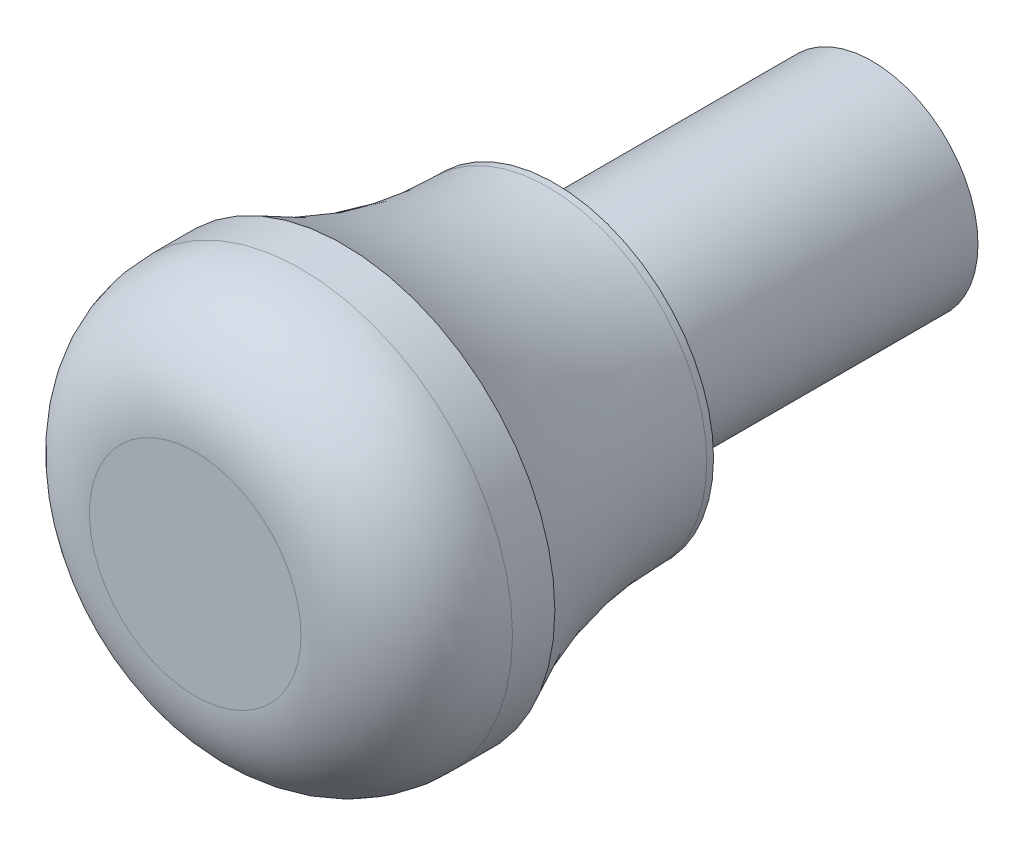
from build123d import *

# Parameters (mm, degrees)
SKETCH1_R           = 5
BOSS_EXTRUDE1_DEPTH = 15
SKETCH2_R           = 7.5
BOSS_EXTRUDE2_DEPTH = 10
SKETCH3_R           = 10
BOSS_EXTRUDE3_DEPTH = 7
FILLET1_R           = 20
FILLET2_R           = 5


with BuildPart() as part:
    # Sketch1 → Boss-Extrude1 (new body)
    with BuildSketch(Plane.XY):
        Circle(SKETCH1_R)
    extrude(amount=BOSS_EXTRUDE1_DEPTH)

    # Sketch2 → Boss-Extrude2 (add)
    with BuildSketch(Plane.XY.offset(15)):
        Circle(SKETCH2_R)
    extrude(amount=BOSS_EXTRUDE2_DEPTH)

    # Sketch3 → Boss-Extrude3 (add)
    with BuildSketch(Plane.XY.offset(25)):
        Circle(SKETCH3_R)
    extrude(amount=BOSS_EXTRUDE3_DEPTH)

    # Fillet1
    # the kernel refuses this fillet: 20 mm, written as the material it adds along each edge
    with BuildSketch(Plane(origin=(0, 0, 25), x_dir=(1, 0, 0), z_dir=(0, -1, 0))) as fillet1_piece_1:
        with BuildLine():
            CenterArc((27.5, -9.682458366), FILLET1_R, 151.044975628, 28.955024372)
            Line((7.5, -9.682458366), (7.1, -9.682458366))
            Line((7.1, -9.682458366), (7.1, 0))
            Line((7.1, 0), (7.5, 0.4))
            ThreePointArc((7.5, 0.4), (8.75, 0.4), (9.65, 0.193649167))
            Line((9.65, 0.193649167), (10, 0))
        make_face()
    revolve(axis=Axis((0, 0, 25), (0, 0, 1)))

    # Fillet2
    fillet2_edges = [part.edges().sort_by_distance(p)[0] for p in [
        (-10, 0, 32),
    ]]
    fillet(fillet2_edges, radius=FILLET2_R)


solid = part.part
